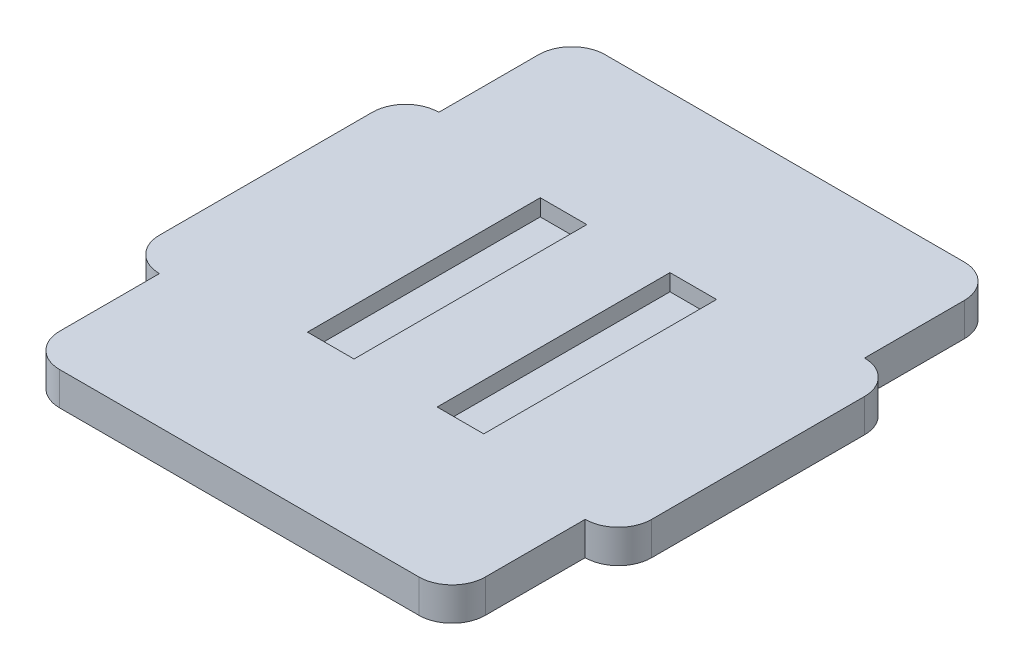
from build123d import *

# Parameters (mm, degrees)
SKETCH2_W           = 7
SKETCH2_H           = 35
BOSS_EXTRUDE1_DEPTH = 5
SKETCH2_3_W         = 7
SKETCH2_3_H         = 35
BOSS_EXTRUDE2_DEPTH = 5
SKETCH3_W           = 7
SKETCH3_H           = 35
CUT_EXTRUDE1_DEPTH  = 2.5


with BuildPart() as part:
    # Sketch2 → Boss-Extrude1 (new body)
    with BuildSketch(Plane(origin=(0, 0, 0), x_dir=(1, 0, 0), z_dir=(0, 1, 0))):
        with BuildLine():
            Line((-18, 57), (-18, 42))
            ThreePointArc((-18, 42), (-21.535533906, 40.535533906), (-23, 37))
            Line((-23, 37), (-23, 5))
            ThreePointArc((-23, 5), (-21.535533906, 1.464466094), (-18, 0))
            Line((-18, 0), (-18, -15))
            ThreePointArc((-18, -15), (-16.535533906, -18.535533906), (-13, -20))
            Line((-13, -20), (41, -20))
            ThreePointArc((41, -20), (44.535533906, -18.535533906), (46, -15))
            Line((46, -15), (46, 0))
            ThreePointArc((46, 0), (49.535533906, 1.464466094), (51, 5))
            Line((51, 5), (51, 37))
            ThreePointArc((51, 37), (49.535533906, 40.535533906), (46, 42))
            Line((46, 42), (46, 57))
            ThreePointArc((46, 57), (44.535533906, 60.535533906), (41, 62))
            Line((41, 62), (-13, 62))
            ThreePointArc((-13, 62), (-16.535533906, 60.535533906), (-18, 57))
        make_face()
        with Locations((-3.5, 21)):
            Rectangle(SKETCH2_W, SKETCH2_H, mode=Mode.SUBTRACT)
        with Locations((31.5, 21)):
            Rectangle(SKETCH2_W, SKETCH2_H, mode=Mode.SUBTRACT)
    extrude(amount=BOSS_EXTRUDE1_DEPTH)

    # Sketch2<3> → Boss-Extrude2 (add)
    with BuildSketch(Plane(origin=(0, 0, 0), x_dir=(1, 0, 0), z_dir=(0, 1, 0))):
        with Locations((-3.5, 21)):
            Rectangle(SKETCH2_3_W, SKETCH2_3_H)
        with Locations((31.5, 21)):
            Rectangle(SKETCH2_3_W, SKETCH2_3_H)
    extrude(amount=BOSS_EXTRUDE2_DEPTH)

    # Sketch3 → Cut-Extrude1 (cut)
    with BuildSketch(Plane(origin=(0, 5, 0), x_dir=(1, 0, 0), z_dir=(0, 1, 0))):
        with Locations((23.75, 21)):
            Rectangle(SKETCH3_W, SKETCH3_H)
        with Locations((4.25, 21)):
            Rectangle(SKETCH3_W, SKETCH3_H)
    extrude(amount=-CUT_EXTRUDE1_DEPTH, mode=Mode.SUBTRACT)


solid = part.part
